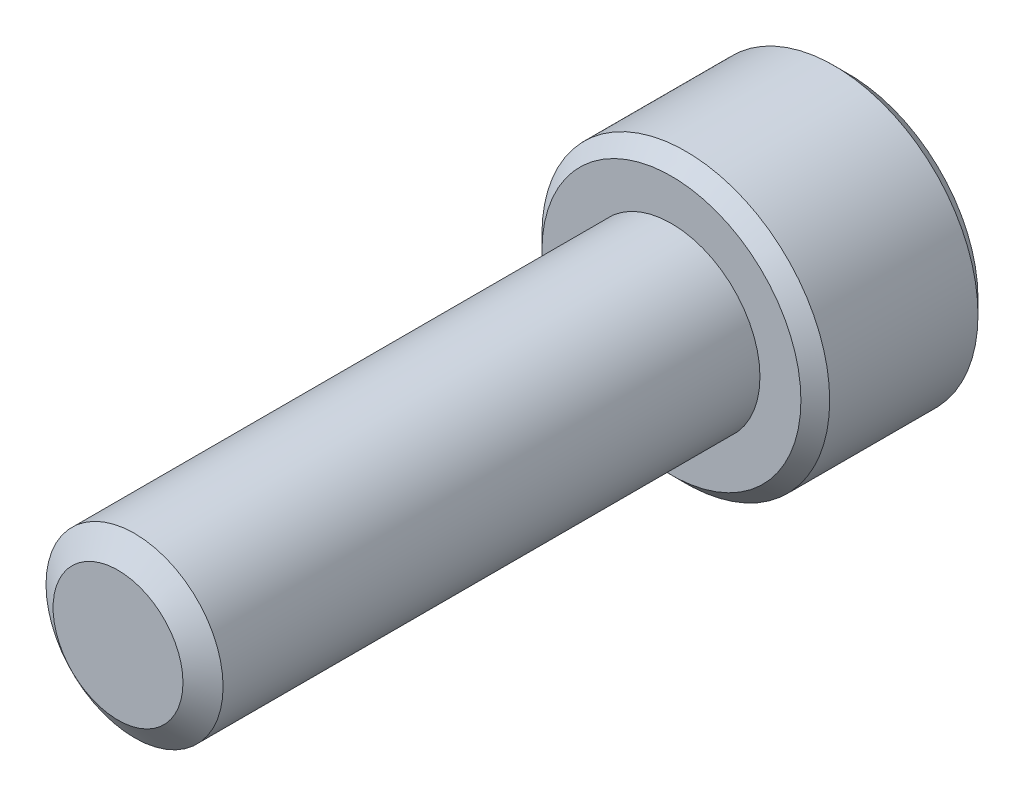
from build123d import *

# Parameters (mm, degrees)
SKETCH1_R          = 4
EXTRUDE1_DEPTH     = 25
SKETCH6_R          = 6.5
EXTRUDE2_DEPTH     = 8
CUT_EXTRUDE1_DEPTH = 4.5
CHAMFER1_SIZE      = 0.65


with BuildPart() as part:
    # Sketch1 → Extrude1 (new body)
    with BuildSketch(Plane.XY):
        Circle(SKETCH1_R)
    extrude(amount=-EXTRUDE1_DEPTH)

    # Sketch4 → Cut-Revolve1 (revolve, cut)
    with BuildSketch(Plane(origin=(0, 0, 0), x_dir=(0, 0, -1), z_dir=(1, 0, 0))):
        Polygon((0.746350386, 4), (0, 2.934101184), (0, 4), align=None)
    revolve(axis=Axis((0, 0, 0), (0, 0, -1)), mode=Mode.SUBTRACT)

    # Sketch6 → Extrude2 (add)
    with BuildSketch(Plane(origin=(0, 0, -25), x_dir=(-1, 0, 0), z_dir=(0, 0, -1))):
        Circle(SKETCH6_R)
    extrude(amount=EXTRUDE2_DEPTH)

    # Sketch7 → Cut-Extrude1 (cut)
    with BuildSketch(Plane(origin=(0, 0, -33), x_dir=(-1, 0, 0), z_dir=(0, 0, -1))):
        Polygon((0, 3.464101615), (-3, 1.732050808), (-3, -1.732050808), (0, -3.464101615), (3, -1.732050808), (3, 1.732050808), align=None)
    extrude(amount=-CUT_EXTRUDE1_DEPTH, mode=Mode.SUBTRACT)

    # Cut-Extrude2 cone 1 section (through the dimple's axis) → Cut-Extrude2 (revolve, cut)
    with BuildSketch(Plane(origin=(0, 0, -33), x_dir=(0, 1, 0), z_dir=(1, 0, 0))):
        Polygon((0, 0), (3.464101615, 0), (0, 3.464101615), align=None)
    revolve(axis=Axis((0, 0, -33), (0, 0, 1)), mode=Mode.SUBTRACT)

    # Chamfer1
    chamfer1_edges = [part.edges().sort_by_distance(p)[0] for p in [
        (6.5, 0, -33),
        (6.5, 0, -25),
    ]]
    chamfer(chamfer1_edges, length=CHAMFER1_SIZE)


solid = part.part
